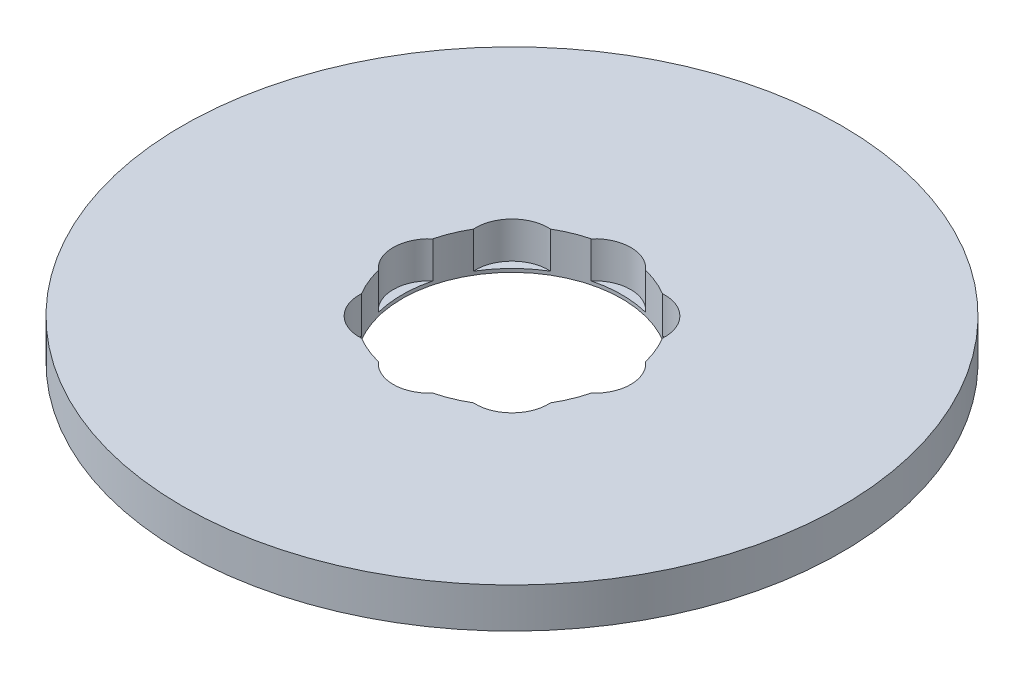
from build123d import *

# Parameters (mm, degrees)
SKETCH1_R           = 82.5
BOSS_EXTRUDE1_DEPTH = 10
SKETCH2_R           = 27.5
CUT_EXTRUDE1_DEPTH  = 118.100384286
SKETCH3_R           = 9.095715255
CUT_EXTRUDE2_DEPTH  = 9.136446443
CIRPATTERN1_COUNT   = 8


with BuildPart() as part:
    # Sketch1 → Boss-Extrude1 (new body)
    with BuildSketch(Plane(origin=(0, 0, 0), x_dir=(1, 0, 0), z_dir=(0, 1, 0))):
        Circle(SKETCH1_R)
    extrude(amount=BOSS_EXTRUDE1_DEPTH)

    # Sketch2 → Cut-Extrude1 (cut, through all)
    with BuildSketch(Plane(origin=(0, 0, 0), x_dir=(1, 0, 0), z_dir=(0, 1, 0))):
        Circle(SKETCH2_R)
    extrude(amount=CUT_EXTRUDE1_DEPTH, mode=Mode.SUBTRACT)

    # Sketch3 → Cut-Extrude2 (cut)
    with BuildSketch(Plane(origin=(0, 10, 0), x_dir=(1, 0, 0), z_dir=(0, 1, 0))):
        with Locations((-20.626833442, 0)):
            Circle(SKETCH3_R)
    cut_extrude2 = extrude(amount=-CUT_EXTRUDE2_DEPTH, mode=Mode.SUBTRACT)

    # CirPattern1: Cut-Extrude2 ×8 about axis
    cirpattern1_axis = Axis((0, 0, 0), (0, 1, 0))
    for i in range(1, CIRPATTERN1_COUNT):
        add(cut_extrude2.rotate(cirpattern1_axis, i * 360 / CIRPATTERN1_COUNT), mode=Mode.SUBTRACT)


solid = part.part
